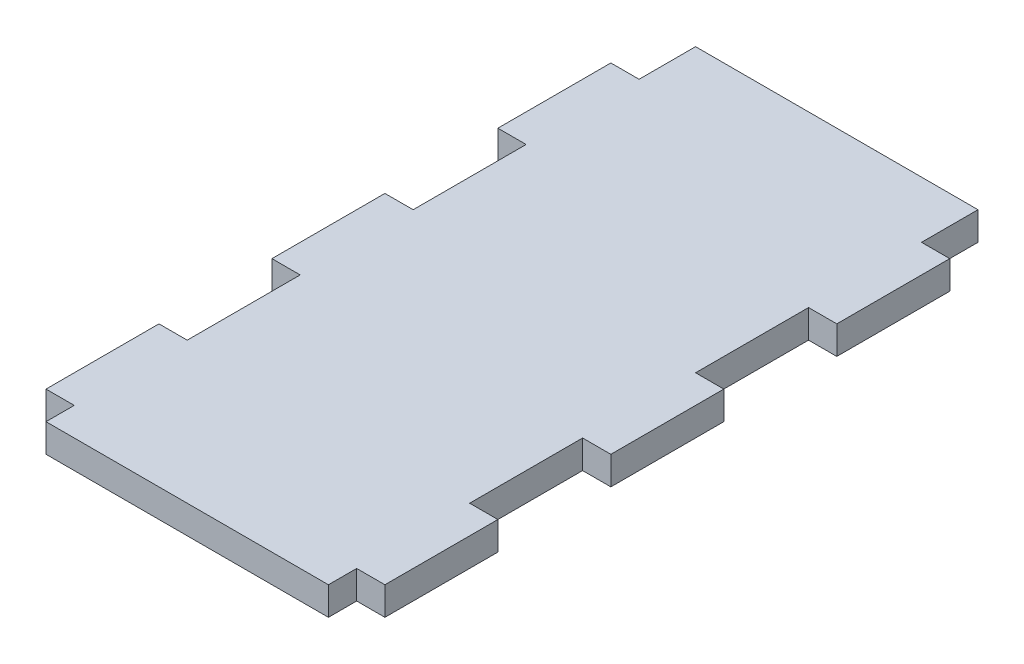
from build123d import *

# Parameters (mm, degrees)
SKETCH1_W           = 76.2
SKETCH1_H           = 127
BOSS_EXTRUDE1_DEPTH = 6.35
CAVITY1_START       = -38.1
CAVITY1_OUTLINE_W   = 6.35
CAVITY1_OUTLINE_H   = 25.4
CAVITY1_DEPTH       = 6.35
CAVITY1_START_2     = 31.75
CAVITY1_2_OUTLINE_W = 6.35
CAVITY1_2_OUTLINE_H = 25.4
CAVITY1_2_DEPTH     = 6.35
SKETCH2_W           = 63.5
SKETCH2_H           = 6.35
BOSS_EXTRUDE2_DEPTH = 6.35
SKETCH3_W           = 63.5
SKETCH3_H           = 6.35
BOSS_EXTRUDE3_DEPTH = 12.7


# Read off the part's stored shape, not the designer's step: Cavity1
with BuildPart() as part:
    # Sketch1 → Boss-Extrude1 (new body)
    with BuildSketch(Plane(origin=(0, 0, 0), x_dir=(1, 0, 0), z_dir=(0, 1, 0))):
        Rectangle(SKETCH1_W, SKETCH1_H)
    extrude(amount=BOSS_EXTRUDE1_DEPTH)

    # Cavity1 outline → Cavity1 (cut)
    with BuildSketch(Plane.YZ.offset(CAVITY1_START)):
        with Locations((3.175, 25.4)):
            Rectangle(CAVITY1_OUTLINE_W, CAVITY1_OUTLINE_H)
        with Locations((3.175, -25.4)):
            Rectangle(CAVITY1_OUTLINE_W, CAVITY1_OUTLINE_H)
    extrude(amount=CAVITY1_DEPTH, mode=Mode.SUBTRACT)

    # Cavity1 2 outline → Cavity1 2 (cut)
    with BuildSketch(Plane.YZ.offset(CAVITY1_START_2)):
        with Locations((3.175, 25.4)):
            Rectangle(CAVITY1_2_OUTLINE_W, CAVITY1_2_OUTLINE_H)
        with Locations((3.175, -25.4)):
            Rectangle(CAVITY1_2_OUTLINE_W, CAVITY1_2_OUTLINE_H)
    extrude(amount=CAVITY1_2_DEPTH, mode=Mode.SUBTRACT)

    # Sketch2 → Boss-Extrude2 (add)
    with BuildSketch(Plane.XY.offset(63.5)):
        with Locations((0, 3.175)):
            Rectangle(SKETCH2_W, SKETCH2_H)
    extrude(amount=BOSS_EXTRUDE2_DEPTH)

    # Sketch3 → Boss-Extrude3 (add)
    with BuildSketch(Plane(origin=(0, 0, -63.5), x_dir=(-1, 0, 0), z_dir=(0, 0, -1))):
        with Locations((0, 3.175)):
            Rectangle(SKETCH3_W, SKETCH3_H)
    extrude(amount=BOSS_EXTRUDE3_DEPTH)


solid = part.part
